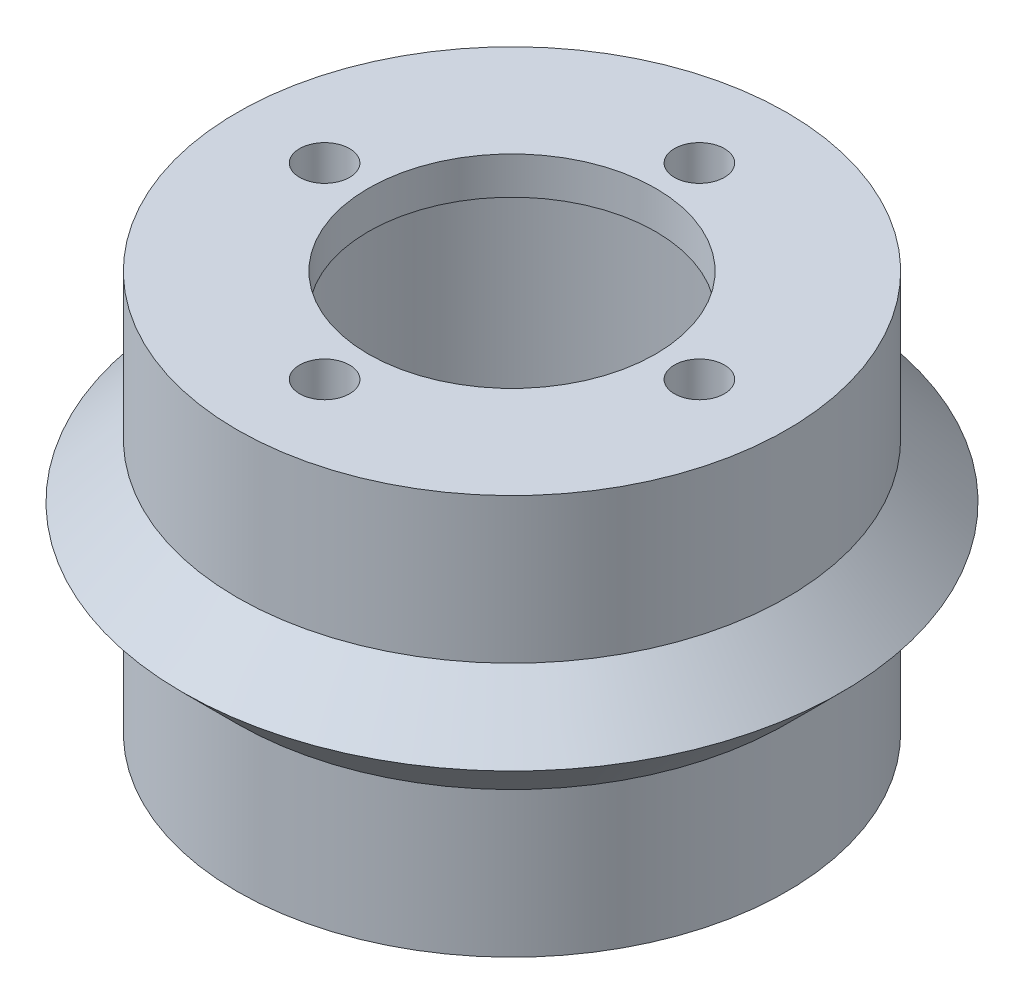
from build123d import *

# Parameters (mm, degrees)
BOSS_EXTRUDE2_START = 3
SKETCH3_R           = 18.5
SKETCH3_R_2         = 2
SKETCH3_R_3         = 11.496935192
BOSS_EXTRUDE2_DEPTH = 3


# Read off the part's stored shape, not the designer's step: Revolve1
with BuildPart() as part:
    # Revolve1 outline → Revolve1 (revolve)
    with BuildSketch(Plane.XY):
        Polygon((26.378679656, 0), (22, 4.378679656), (22, 16), (18.5, 16), (18.5, -16), (22, -16), (22, -4.378679656), align=None)
    revolve(axis=Axis((0, 0, 0), (0, 1, 0)))

    # Sketch3 → Boss-Extrude2 (add)
    with BuildSketch(Plane.XZ.offset(-16).offset(BOSS_EXTRUDE2_START)):
        with Locations(Location((0, 0, 0), (0, 0, 270))):
            Circle(SKETCH3_R)
        with Locations(Location((15, 0, 0), (0, 0, 270))):
            Circle(SKETCH3_R_2, mode=Mode.SUBTRACT)
        with Locations(Location((0, 0, 0), (0, 0, 270))):
            Circle(SKETCH3_R_3, mode=Mode.SUBTRACT)
        with Locations(Location((0, -15, 0), (0, 0, 270))):
            Circle(SKETCH3_R_2, mode=Mode.SUBTRACT)
        with Locations(Location((-15, 0, 0), (0, 0, 270))):
            Circle(SKETCH3_R_2, mode=Mode.SUBTRACT)
        with Locations(Location((0, 15, 0), (0, 0, 270))):
            Circle(SKETCH3_R_2, mode=Mode.SUBTRACT)
    extrude(amount=-BOSS_EXTRUDE2_DEPTH)


solid = part.part
